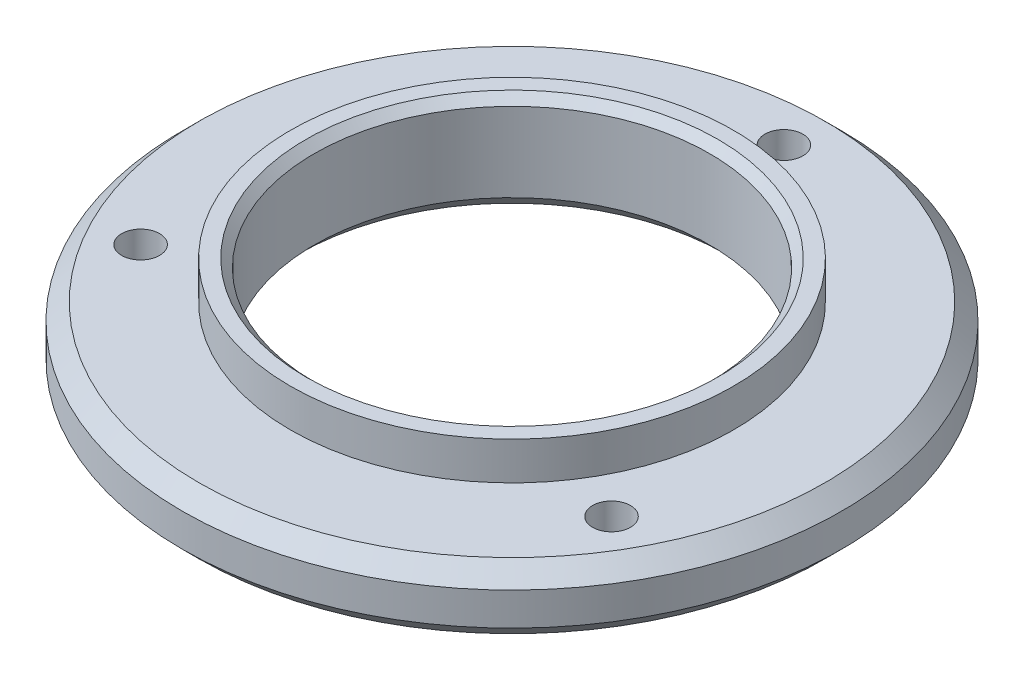
from build123d import *

# Parameters (mm, degrees)
ESQUISSE1_R                = 20
ESQUISSE1_R_2              = 12
ESQUISSE1_R_3              = 1.15
BOSS_EXTRU_1_DEPTH         = 4
PER_AGEAVANC_1_OUTLINE_R   = 2.2
PER_AGEAVANC_1_OUTLINE_R_2 = 1.15
PER_AGEAVANC_1_DEPTH       = 2
BOSS_EXTRU_2_START         = -4
ESQUISSE3_R                = 13.45
ESQUISSE3_R_2              = 12
BOSS_EXTRU_2_DEPTH         = 2.3
CHANFREIN1_SIZE            = 0.5
CHANFREIN2_SIZE            = 1


# Read off the part's stored shape, not the designer's step: PerçageAvancé1
with BuildPart() as part:
    # Esquisse1 → Boss.-Extru.1 (new body)
    with BuildSketch(Plane(origin=(0, 0, 0), x_dir=(1, 0, 0), z_dir=(0, 1, 0))):
        with Locations(Location((0, 0, 0), (0, 0, 270))):
            Circle(ESQUISSE1_R)
        with Locations(Location((0, 0, 0), (0, 0, 270))):
            Circle(ESQUISSE1_R_2, mode=Mode.SUBTRACT)
        with Locations(Location((-14.289419162, -8.25, 0), (0, 0, 270))):
            Circle(ESQUISSE1_R_3, mode=Mode.SUBTRACT)
        with Locations(Location((14.289419162, -8.25, 0), (0, 0, 270))):
            Circle(ESQUISSE1_R_3, mode=Mode.SUBTRACT)
        with Locations(Location((0, 16.5, 0), (0, 0, 270))):
            Circle(ESQUISSE1_R_3, mode=Mode.SUBTRACT)
    extrude(amount=BOSS_EXTRU_1_DEPTH)

    # PerçageAvancé1 outline → PerçageAvancé1 (cut)
    # profile 1 of 3: a face of its own
    with BuildSketch(Plane(origin=(0, 0, 0), x_dir=(1, 0, 0), z_dir=(0, 1, 0))):
        with Locations((-14.289419162, -8.25)):
            Circle(PER_AGEAVANC_1_OUTLINE_R)
        with Locations((-14.289419162, -8.25)):
            Circle(PER_AGEAVANC_1_OUTLINE_R_2, mode=Mode.SUBTRACT)
    # profile 2 of 3: a face of its own
    with BuildSketch(Plane(origin=(0, 0, 0), x_dir=(1, 0, 0), z_dir=(0, 1, 0))):
        with Locations((14.289419162, -8.25)):
            Circle(PER_AGEAVANC_1_OUTLINE_R)
        with Locations((14.289419162, -8.25)):
            Circle(PER_AGEAVANC_1_OUTLINE_R_2, mode=Mode.SUBTRACT)
    # profile 3 of 3: a face of its own
    with BuildSketch(Plane(origin=(0, 0, 0), x_dir=(1, 0, 0), z_dir=(0, 1, 0))):
        with Locations((0, 16.5)):
            Circle(PER_AGEAVANC_1_OUTLINE_R)
        with Locations((0, 16.5)):
            Circle(PER_AGEAVANC_1_OUTLINE_R_2, mode=Mode.SUBTRACT)
    extrude(amount=PER_AGEAVANC_1_DEPTH, mode=Mode.SUBTRACT)

    # Esquisse3 → Boss.-Extru.2 (add)
    with BuildSketch(Plane.XZ.offset(BOSS_EXTRU_2_START)):
        with Locations(Location((0, 0, 0), (0, 0, 90))):
            Circle(ESQUISSE3_R)
        with Locations(Location((0, 0, 0), (0, 0, 90))):
            Circle(ESQUISSE3_R_2, mode=Mode.SUBTRACT)
    extrude(amount=-BOSS_EXTRU_2_DEPTH)

    # Chanfrein1
    chanfrein1_edges = [part.edges().sort_by_distance(p)[0] for p in [
        (0, 6.3, -12),
    ]]
    chamfer(chanfrein1_edges, length=CHANFREIN1_SIZE)

    # Chanfrein2
    chanfrein2_edges = [part.edges().sort_by_distance(p)[0] for p in [
        (0, 4, -20),
        (0, 0, -20),
        (0, 0, -12),
    ]]
    chamfer(chanfrein2_edges, length=CHANFREIN2_SIZE)


solid = part.part
